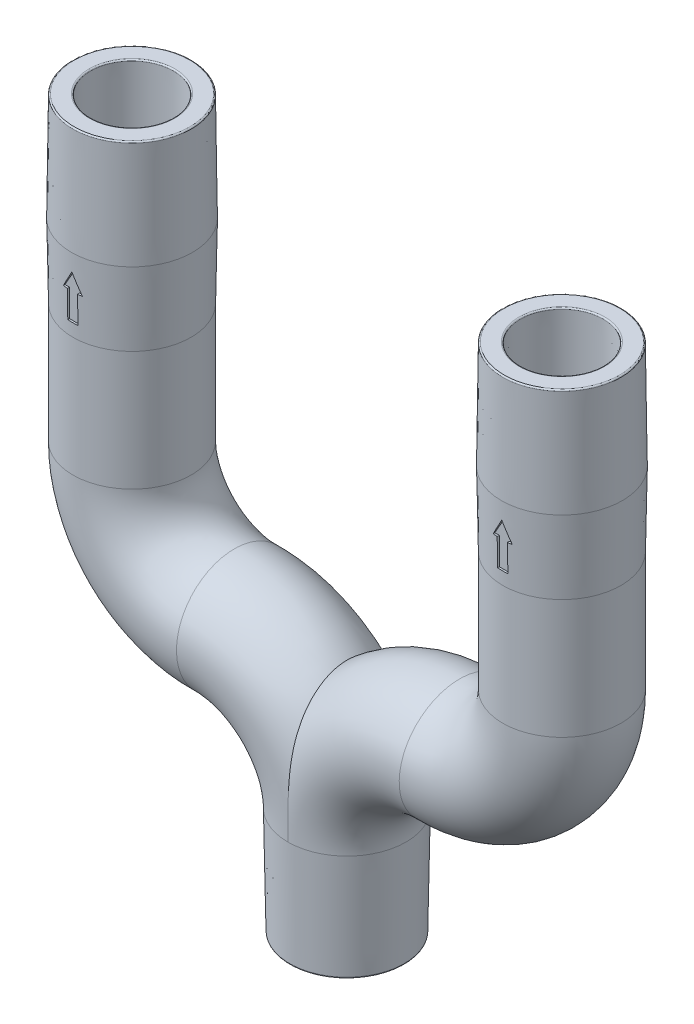
from build123d import *

# Parameters (mm, degrees)
BOSS_EXTRUDE4_DEPTH  = 12.859999996
FILLET1_R            = 1
FILLET2_R            = 0.25
FILLET3_R            = 3
SWEEP1_PROFILE_R     = 11
CUT_SWEEP1_PROFILE_R = 8
CUT_EXTRUDE9_DEPTH   = 0.6
FILLET6_R            = 0.25


# Read off the part's stored shape, not the designer's step: Mirror3, Mirror4, Draft2
with BuildPart() as part:
    # Sketch1 → Revolve1 (revolve)
    with BuildSketch(Plane(origin=(0, 0, 0), x_dir=(0, 0, -1), z_dir=(1, 0, 0)), mode=Mode.PRIVATE) as revolve1_sk:
        Polygon((7.725, 54), (7.55, 38.771909976), (10, 32.871909976), (10, 29.611909976), (8, 29.611909976), (8, 16.751909976), (7.41, 15.73), (7.725, 0), (11, 0), (11, 20.2), (11.25, 34), (11, 54), align=None)
    revolve(revolve1_sk.sketch.rotate(Axis((0, 25.776699029, 0), (0, -1, 0)), 180), axis=Axis((0, 25.776699029, 0), (0, -1, 0)))

    # Sketch2 → Boss-Extrude4 (add)
    with BuildSketch(Plane(origin=(0, 16.75190998, 0), x_dir=(1, 0, 0), z_dir=(0, 1, 0))):
        with BuildLine():
            Line((4.062019202, -0.75), (7.395099729, -0.75))
            ThreePointArc((7.395099729, -0.75), (7.776981037, -0.927251388), (7.888106377, -1.333333333))
            ThreePointArc((7.888106377, -1.333333333), (8, 0), (7.888106377, 1.333333333))
            ThreePointArc((7.888106377, 1.333333333), (7.776981037, 0.927251388), (7.395099729, 0.75))
            Line((7.395099729, 0.75), (4.062019202, 0.75))
            ThreePointArc((4.062019202, 0.75), (3.764974939, 0.847800167), (3.58413459, 1.102941176))
            ThreePointArc((3.58413459, 1.102941176), (3.247595264, 1.875), (2.747242373, 2.552481018))
            ThreePointArc((2.747242373, 2.552481018), (2.616703951, 2.836663859), (2.680528654, 3.14281182))
            Line((2.680528654, 3.14281182), (4.347068917, 6.029344229))
            ThreePointArc((4.347068917, 6.029344229), (4.691513776, 6.271437449), (5.098753727, 6.164633844))
            ThreePointArc((5.098753727, 6.164633844), (4, 6.92820323), (2.78935265, 7.497967177))
            ThreePointArc((2.78935265, 7.497967177), (3.085467261, 7.198688837), (3.048030812, 6.779344229))
            Line((3.048030812, 6.779344229), (1.381490548, 3.89281182))
            ThreePointArc((1.381490548, 3.89281182), (1.148270988, 3.684464026), (0.836892217, 3.655422194))
            ThreePointArc((0.836892217, 3.655422194), (0, 3.75), (-0.836892217, 3.655422194))
            ThreePointArc((-0.836892217, 3.655422194), (-1.148270988, 3.684464026), (-1.381490548, 3.89281182))
            Line((-1.381490548, 3.89281182), (-3.048030812, 6.779344229))
            ThreePointArc((-3.048030812, 6.779344229), (-3.085467261, 7.198688837), (-2.78935265, 7.497967177))
            ThreePointArc((-2.78935265, 7.497967177), (-4, 6.92820323), (-5.098753727, 6.164633844))
            ThreePointArc((-5.098753727, 6.164633844), (-4.691513776, 6.271437449), (-4.347068917, 6.029344229))
            Line((-4.347068917, 6.029344229), (-2.680528654, 3.14281182))
            ThreePointArc((-2.680528654, 3.14281182), (-2.616703951, 2.836663859), (-2.747242373, 2.552481018))
            ThreePointArc((-2.747242373, 2.552481018), (-3.247595264, 1.875), (-3.58413459, 1.102941176))
            ThreePointArc((-3.58413459, 1.102941176), (-3.764974939, 0.847800167), (-4.062019202, 0.75))
            Line((-4.062019202, 0.75), (-7.395099729, 0.75))
            ThreePointArc((-7.395099729, 0.75), (-7.776981037, 0.927251388), (-7.888106377, 1.333333333))
            ThreePointArc((-7.888106377, 1.333333333), (-8, 0), (-7.888106377, -1.333333333))
            ThreePointArc((-7.888106377, -1.333333333), (-7.776981037, -0.927251388), (-7.395099729, -0.75))
            Line((-7.395099729, -0.75), (-4.062019202, -0.75))
            ThreePointArc((-4.062019202, -0.75), (-3.764974939, -0.847800167), (-3.58413459, -1.102941176))
            ThreePointArc((-3.58413459, -1.102941176), (-3.247595264, -1.875), (-2.747242373, -2.552481018))
            ThreePointArc((-2.747242373, -2.552481018), (-2.616703951, -2.836663859), (-2.680528654, -3.14281182))
            Line((-2.680528654, -3.14281182), (-4.347068917, -6.029344229))
            ThreePointArc((-4.347068917, -6.029344229), (-4.691513776, -6.271437449), (-5.098753727, -6.164633844))
            ThreePointArc((-5.098753727, -6.164633844), (-4, -6.92820323), (-2.78935265, -7.497967177))
            ThreePointArc((-2.78935265, -7.497967177), (-3.085467261, -7.198688837), (-3.048030812, -6.779344229))
            Line((-3.048030812, -6.779344229), (-1.381490548, -3.89281182))
            ThreePointArc((-1.381490548, -3.89281182), (-1.148270988, -3.684464026), (-0.836892217, -3.655422194))
            ThreePointArc((-0.836892217, -3.655422194), (0, -3.75), (0.836892217, -3.655422194))
            ThreePointArc((0.836892217, -3.655422194), (1.148270988, -3.684464026), (1.381490548, -3.89281182))
            Line((1.381490548, -3.89281182), (3.048030812, -6.779344229))
            ThreePointArc((3.048030812, -6.779344229), (3.085467261, -7.198688837), (2.78935265, -7.497967177))
            ThreePointArc((2.78935265, -7.497967177), (4, -6.92820323), (5.098753727, -6.164633844))
            ThreePointArc((5.098753727, -6.164633844), (4.691513776, -6.271437449), (4.347068917, -6.029344229))
            Line((4.347068917, -6.029344229), (2.680528654, -3.14281182))
            ThreePointArc((2.680528654, -3.14281182), (2.616703951, -2.836663859), (2.747242373, -2.552481018))
            ThreePointArc((2.747242373, -2.552481018), (3.247595264, -1.875), (3.58413459, -1.102941176))
            ThreePointArc((3.58413459, -1.102941176), (3.764974939, -0.847800167), (4.062019202, -0.75))
        make_face()
    extrude(amount=BOSS_EXTRUDE4_DEPTH)

    # Sketch3 → Cut-Revolve1 (revolve, cut)
    with BuildSketch(Plane.XY, mode=Mode.PRIVATE) as cut_revolve1_sk:
        with BuildLine():
            Line((-2.6, 26.111909976), (-8, 16.75190998))
            Line((-8, 16.75190998), (0, 16.751909976))
            Line((0, 16.751909976), (0, 27.611909976))
            ThreePointArc((0, 27.611909976), (-1.501219512, 27.210690464), (-2.6, 26.111909976))
        make_face()
    revolve(cut_revolve1_sk.sketch.rotate(Axis((0, 0, 0), (0, 1, 0)), 270), axis=Axis((0, 0, 0), (0, 1, 0)), mode=Mode.SUBTRACT)

    # Sketch4 → Revolve2 (revolve)
    with BuildSketch(Plane.XY, mode=Mode.PRIVATE) as revolve2_sk:
        with BuildLine():
            Line((-2.5, 29.611909976), (-2.5, 31.111909976))
            Line((-2.5, 31.111909976), (-3.25, 31.111909976))
            ThreePointArc((-3.25, 31.111909976), (-2.298097039, 33.410007015), (0, 34.361909976))
            Line((0, 34.361909976), (0, 29.611909976))
            Line((0, 29.611909976), (-2.5, 29.611909976))
        make_face()
    revolve(revolve2_sk.sketch.rotate(Axis((0, 0, 0), (0, 1, 0)), 270), axis=Axis((0, 0, 0), (0, 1, 0)))

    # Fillet1
    fillet1_edges = [part.edges().sort_by_distance(p)[0] for p in [
        (0, 15.73, -7.41),
    ]]
    fillet(fillet1_edges, radius=FILLET1_R)

    # Fillet2
    fillet2_edges = [part.edges().sort_by_distance(p)[0] for p in [
        (0, 29.611909976, -10),
        (0, 29.611909976, 2.5),
        (0, 31.111909976, 2.5),
    ]]
    fillet(fillet2_edges, radius=FILLET2_R)

    # Fillet3
    fillet3_edges = [part.edges().sort_by_distance(p)[0] for p in [
        (0, 32.871909976, -10),
        (0, 38.771909976, -7.55),
    ]]
    fillet(fillet3_edges, radius=FILLET3_R)

    # Sweep1: sweep along a path in Sketch8
    with BuildLine(Plane.XY) as sweep1_path:
        Line((-40, -61.143122289), (-40, -41.143122289))
        ThreePointArc((-40, -41.143122289), (-33.902805761, -26.645664916), (-19.276734431, -20.863789329))
        ThreePointArc((-19.276734431, -20.863789329), (-5.671596193, -15.485501827), (0, -2))
        Line((0, -2), (0, 0))
    # Sweep1 profile (on start of the path) → Sweep1 (sweep)
    with BuildSketch(Plane(origin=(-40, -61.143122289, 0), x_dir=(0, 0, 1), z_dir=(0, 1, 0))):
        Circle(SWEEP1_PROFILE_R)
    sweep(path=sweep1_path.line)

    # Mirror3
    split(bisect_by=Plane(origin=(-40, 0, 0), x_dir=(0, 0, 1), z_dir=(1, 0, 0)), keep=Keep.TOP)

    # Mirror3 2: part across plane


with BuildPart() as part_1:
    add(part.part)
    add(part.part.mirror(Plane(origin=(-40, 0, 0), x_dir=(0, 0, 1), z_dir=(1, 0, 0))))

    # Cut-Sweep1: sweep along a path in Sketch8<4>
    with BuildLine(Plane.XY) as cut_sweep1_path:
        Line((-40, -61.143122289), (-40, -41.143122289))
        ThreePointArc((-40, -41.143122289), (-33.902805761, -26.645664916), (-19.276734431, -20.863789329))
        ThreePointArc((-19.276734431, -20.863789329), (-5.671596193, -15.485501827), (0, -2))
        Line((0, -2), (0, 0))
    # Cut-Sweep1 profile (on start of the path) → Cut-Sweep1 (sweep, cut)
    with BuildSketch(Plane(origin=(-40, -61.143122289, 0), x_dir=(0, 0, 1), z_dir=(0, 1, 0))):
        Circle(CUT_SWEEP1_PROFILE_R)
    sweep(path=cut_sweep1_path.line, mode=Mode.SUBTRACT)

    # Mirror4
    split(bisect_by=Plane(origin=(-40, 0, 0), x_dir=(0, 0, 1), z_dir=(1, 0, 0)), keep=Keep.TOP)

    # Mirror4 2: part across plane


with BuildPart() as part_2:
    add(part_1.part)
    add(part_1.part.mirror(Plane(origin=(-40, 0, 0), x_dir=(0, 0, 1), z_dir=(1, 0, 0))))

    # Sketch53 → Cut-Extrude9 (cut)
    with BuildSketch(Plane.XY.offset(11.3)):
        Polygon((0, 30.826484467), (1.778537377, 27.667512667), (0.951205041, 27.667512667), (0.951205041, 22.591698133), (-0.951205041, 22.591698133), (-0.951205041, 27.667512667), (-1.778537377, 27.667512667), align=None)
        Polygon((-80, 30.826484467), (-78.221462623, 27.667512667), (-79.048794959, 27.667512667), (-79.048794959, 22.591698133), (-80.951205041, 22.591698133), (-80.951205041, 27.667512667), (-81.778537377, 27.667512667), align=None)
    extrude(amount=-CUT_EXTRUDE9_DEPTH, mode=Mode.SUBTRACT)

    # Draft2 outline → Draft2 (revolve, cut)
    with BuildSketch(Plane(origin=(-40, 0, 0), x_dir=(1, 0, 0), z_dir=(0, 0, 1))):
        Polygon((11, -41.143122289), (10.650898701, -61.143122289), (11, -61.143122289), align=None)
    revolve(axis=Axis((-40, 0, 0), (0, 1, 0)), mode=Mode.SUBTRACT)

    # Fillet6
    fillet6_edges = [part_2.edges().sort_by_distance(p)[0] for p in [
        (0, 54, -7.725),
        (-32.468677303, -61.143122289, -7.531322697),
        (-80, 54, -7.725),
        (-80, 54, -11),
        (-32, -61.143122289, 0),
        (0, 54, -11),
    ]]
    fillet(fillet6_edges, radius=FILLET6_R)


solid = part_2.part
